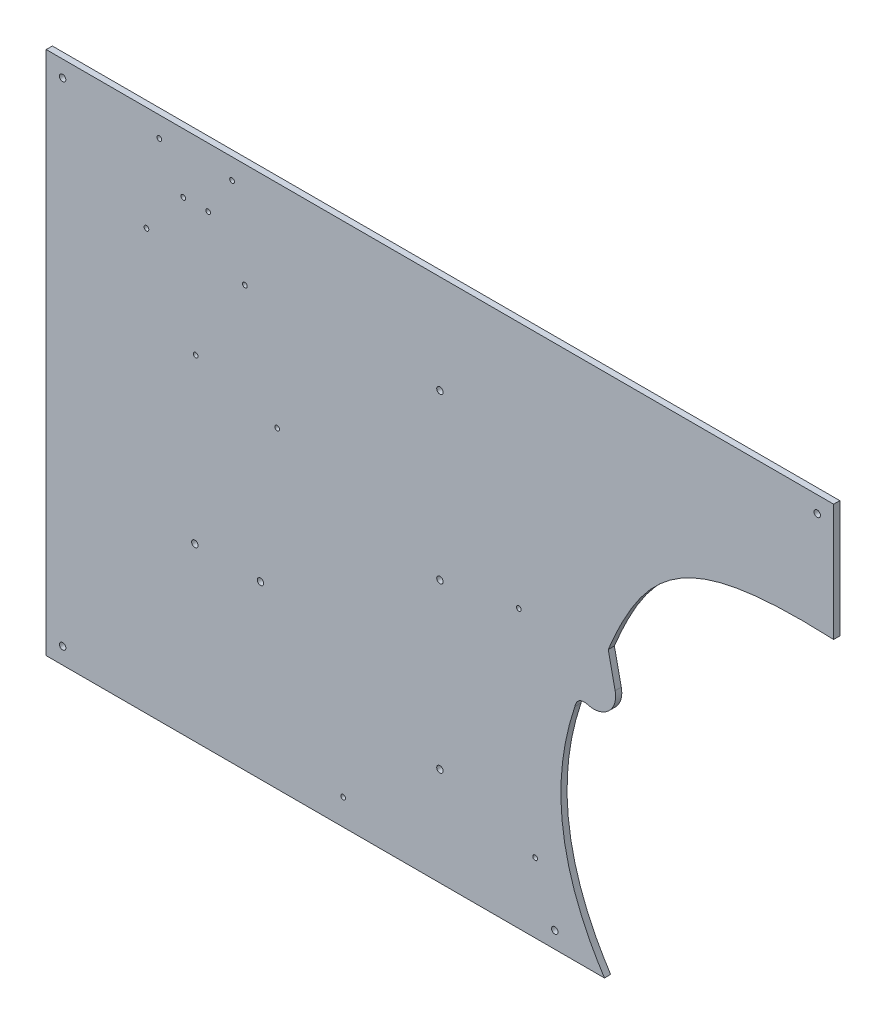
from build123d import *

# Parameters (mm, degrees)
SKETCH1_W                  = 609.6
SKETCH1_H                  = 406.4
BOSS_EXTRUDE1_DEPTH        = 4.7625
F_10_CLEARANCE_HOLE1_D     = 4.9784
F_10_CLEARANCE_HOLE1_DEPTH = 10.16
F_10_CLEARANCE_HOLE1_TIP   = 1.495662253
F_6_CLEARANCE_HOLE1_D      = 3.6576
F_6_CLEARANCE_HOLE1_DEPTH  = 10.16
F_6_CLEARANCE_HOLE1_TIP    = 1.0988539
F_10_CLEARANCE_HOLE2_D     = 4.9784
F_10_CLEARANCE_HOLE2_DEPTH = 10.16
F_10_CLEARANCE_HOLE2_TIP   = 1.495662253
CUT_EXTRUDE6_DEPTH         = 733.663498071


with BuildPart() as part:
    # Sketch1 → Boss-Extrude1 (new body)
    with BuildSketch(Plane.XY):
        with Locations((304.8, 203.2)):
            Rectangle(SKETCH1_W, SKETCH1_H)
    extrude(amount=BOSS_EXTRUDE1_DEPTH)

    # #10 Clearance Hole1
    with Locations(Plane.XY.offset(4.7625)):
        with Locations((393.7, 12.7), (304.8, 203.2), (596.9, 393.7), (12.7, 12.7), (12.7, 393.7), (596.9, 12.7), (304.8, 330.2), (304.8, 76.2)):
            Hole(F_10_CLEARANCE_HOLE1_D / 2, depth=F_10_CLEARANCE_HOLE1_DEPTH)
            with Locations((0, 0, -(F_10_CLEARANCE_HOLE1_DEPTH + F_10_CLEARANCE_HOLE1_TIP / 2))):  # 118° drill point
                Cone(0, F_10_CLEARANCE_HOLE1_D / 2, F_10_CLEARANCE_HOLE1_TIP, mode=Mode.SUBTRACT)

    # #6 Clearance Hole1
    with Locations(Plane.XY.offset(4.7625)):
        with Locations((153.8, 325.397045256), (115.7, 259.405909488), (77.6, 325.397045256), (178.748637136, 241.986495315), (365.913011093, 214.603454564), (378.514626904, 53.804869065), (229.881403774, 20.131066458), (87.511505802, 390.539377284), (106.048, 360.365035489), (125.352, 360.365035489), (143.888494198, 390.539377284)):
            Hole(F_6_CLEARANCE_HOLE1_D / 2, depth=F_6_CLEARANCE_HOLE1_DEPTH)
            with Locations((0, 0, -(F_6_CLEARANCE_HOLE1_DEPTH + F_6_CLEARANCE_HOLE1_TIP / 2))):  # 118° drill point
                Cone(0, F_6_CLEARANCE_HOLE1_D / 2, F_6_CLEARANCE_HOLE1_TIP, mode=Mode.SUBTRACT)

    # #10 Clearance Hole2
    with Locations(Plane.XY.offset(4.7625)):
        with Locations((165.89375, 132.55625), (115.09375, 132.55625)):
            Hole(F_10_CLEARANCE_HOLE2_D / 2, depth=F_10_CLEARANCE_HOLE2_DEPTH)
            with Locations((0, 0, -(F_10_CLEARANCE_HOLE2_DEPTH + F_10_CLEARANCE_HOLE2_TIP / 2))):  # 118° drill point
                Cone(0, F_10_CLEARANCE_HOLE2_D / 2, F_10_CLEARANCE_HOLE2_TIP, mode=Mode.SUBTRACT)

    # Sketch14 → Cut-Extrude6 (cut, through all)
    with BuildSketch(Plane.XY):
        with BuildLine():
            Line((609.6, 315.642514433), (609.6, 0))
            Line((609.6, 0), (432.195867807, 0))
            add(Edge.make_bspline(
                [(409.29659152, 170.617944662), (389.336707443, 111.226571114), (396.96980279, 54.353932563), (432.195867807, 0)],
                knots=[0.116936562, 0.116936562, 0.116936562, 0.116936562, 1, 1, 1, 1], degree=3))
            add(Edge.make_bspline(
                [(418.07234083, 177.13057308), (410.929678592, 177.953538089), (409.29659152, 170.617944662)],
                knots=[0, 0, 0, 1, 1, 1], degree=2))
            ThreePointArc((418.07234083, 177.13057308), (435.035932656, 180.354053738), (440.45974614, 196.747238983))
            Line((440.45974614, 196.747238983), (435.086955617, 221.682561203))
            add(Edge.make_bspline(
                [(435.086955617, 221.682561203), (465.243862883, 294.790369183), (498.032190497, 320.641169761), (609.6, 315.642514433)],
                knots=[0.107898544, 0.107898544, 0.107898544, 0.107898544, 1, 1, 1, 1], degree=3))
        make_face()
    extrude(amount=CUT_EXTRUDE6_DEPTH, mode=Mode.SUBTRACT)


solid = part.part
